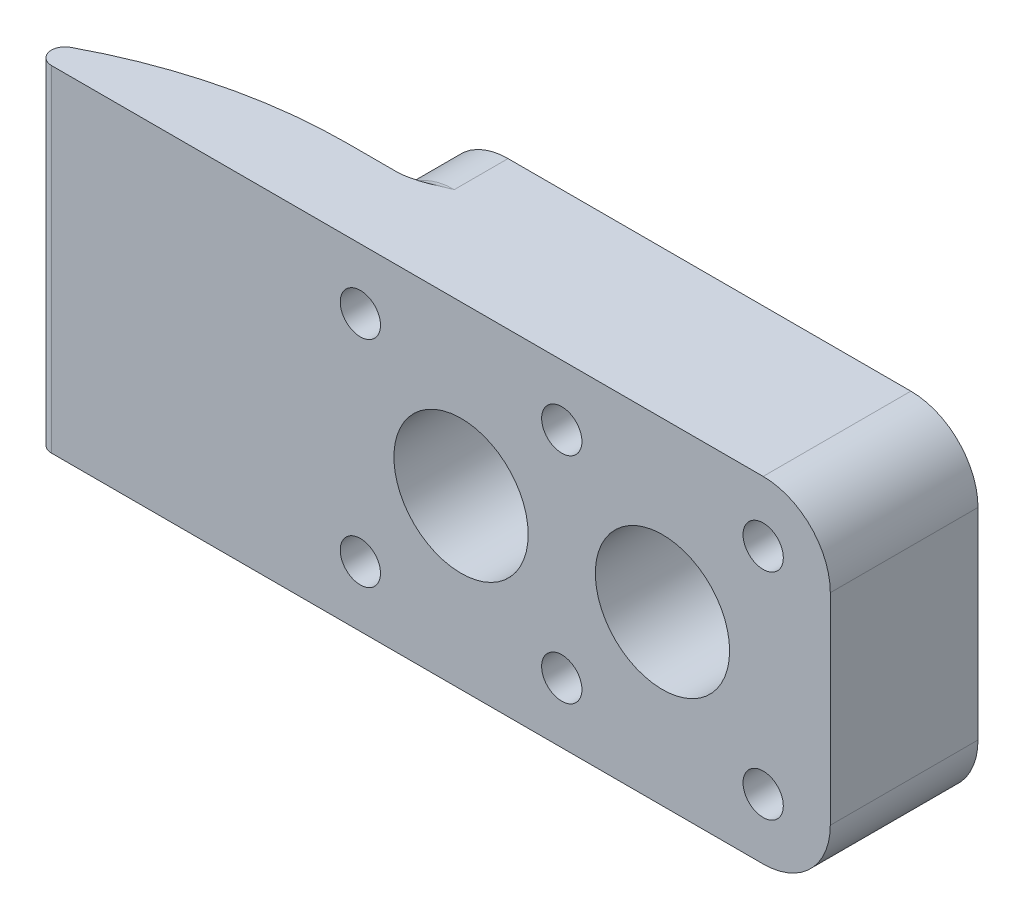
from build123d import *

# Parameters (mm, degrees)
SKETCH_2_W           = 40
SKETCH_2_H           = 25
EXTRUDE_1_DEPTH      = 5
SKETCH_3_R           = 1.5
CUT_EXTRUDE_1_DEPTH  = 25.109126902
SKETCH_4_R           = 5
CUT_EXTRUDE_2_DEPTH  = 25.109126902
EXTRUDE_2_DEPTH      = 12.5
EXTRUDE_2_DEPTH_BACK = 12.5
SKETCH_7_R           = 5
SKETCH_7_R_2         = 1.5
CUT_EXTRUDE_3_DEPTH  = 43.405777908
FILLET_1_R           = 5
FILLET_2_R           = 1


with BuildPart() as part:
    # 草图2 → 凸台-拉伸1 (new body)
    with BuildSketch(Plane.XY):
        Rectangle(SKETCH_2_W, SKETCH_2_H)
    extrude(amount=EXTRUDE_1_DEPTH)

    # 草图3 → 切除-拉伸1 (cut, through all)
    with BuildSketch(Plane.XY.offset(5)):
        with Locations((-15, 8)):
            Circle(SKETCH_3_R)
        with Locations((0, 8)):
            Circle(SKETCH_3_R)
        with Locations(Location((15, 8, 0), (0, 0, 180))):
            Circle(SKETCH_3_R)
        with Locations((15, -8)):
            Circle(SKETCH_3_R)
        with Locations(Location((0, -8, 0), (0, 0, 180))):
            Circle(SKETCH_3_R)
        with Locations(Location((-15, -8, 0), (0, 0, 180))):
            Circle(SKETCH_3_R)
    extrude(amount=-CUT_EXTRUDE_1_DEPTH, mode=Mode.SUBTRACT)

    # 草图4 → 切除-拉伸2 (cut, through all)
    with BuildSketch(Plane.XY.offset(5)):
        with Locations((-7.5, 0)):
            Circle(SKETCH_4_R)
        with Locations(Location((7.5, 0, 0), (0, 0, 180))):
            Circle(SKETCH_4_R)
    extrude(amount=-CUT_EXTRUDE_2_DEPTH, mode=Mode.SUBTRACT)

    # 草图6 → 凸台-拉伸2 (add, two sides: drawn at the far end of the back side and taken through both)
    with BuildSketch(Plane(origin=(0, 0, 0), x_dir=(1, 0, 0), z_dir=(0, 1, 0)).offset(-EXTRUDE_2_DEPTH_BACK)):
        with BuildLine():
            Line((-20, -5), (-22, -5))
            ThreePointArc((-22, -5), (-30.488746876, -6.045012495), (-38.470588235, -9.117647059))
            ThreePointArc((-38.470588235, -9.117647059), (-38.9701425, -10.242535625), (-38, -11))
            Line((-38, -11), (20, -11))
            Line((20, -11), (20, -5))
            Line((20, -5), (-20, -5))
        make_face()
    extrude(amount=EXTRUDE_2_DEPTH + EXTRUDE_2_DEPTH_BACK)

    # 草图7 → 切除-拉伸3 (cut, through all)
    with BuildSketch(Plane.XY.offset(11)):
        with Locations((7.5, 0)):
            Circle(SKETCH_7_R)
        with Locations((-15, -8)):
            Circle(SKETCH_7_R_2)
        with Locations((-7.5, 0)):
            Circle(SKETCH_7_R)
        with Locations((0, -8)):
            Circle(SKETCH_7_R_2)
        with Locations((15, -8)):
            Circle(SKETCH_7_R_2)
        with Locations((0, 8)):
            Circle(SKETCH_7_R_2)
        with Locations((-15, 8)):
            Circle(SKETCH_7_R_2)
        with Locations((15, 8)):
            Circle(SKETCH_7_R_2)
    extrude(amount=-CUT_EXTRUDE_3_DEPTH, mode=Mode.SUBTRACT)

    # 圆角1
    fillet_1_edges = [part.edges().sort_by_distance(p)[0] for p in [
        (20, -12.5, 5.5),
        (-20, -12.5, 2.5),
        (-20, 12.5, 2.5),
        (20, 12.5, 5.5),
    ]]
    fillet(fillet_1_edges, radius=FILLET_1_R)

    # 圆角2
    # the kernel refuses this fillet: 1 mm, written as the material it adds along each edge
    with BuildSketch(Plane(origin=(-20, 7.5, 5), x_dir=(0, 0, -1), z_dir=(0, -1, 0))) as fillet_2_piece_1:
        with BuildLine():
            CenterArc((FILLET_2_R, -FILLET_2_R), FILLET_2_R, 90, 90)
            Line((0, -FILLET_2_R), (0, 0))
            Line((0, 0), (FILLET_2_R, 0))
        make_face()
    extrude(amount=15)
    with BuildSketch(Plane(origin=(-15, -7.5, 5), x_dir=(0.7515057138603054, -0.6597265812708418, 0), z_dir=(0.6597265812708418, 0.7515057138603054, 0))) as fillet_2_piece_2_section:
        with BuildLine():
            CenterArc((5 + FILLET_2_R, FILLET_2_R), FILLET_2_R, 180, 90)
            Line((5, FILLET_2_R), (5, 0))
            Line((5, 0), (5 + FILLET_2_R, 0))
        make_face()
    fillet_2_piece_2 = revolve(axis=Axis((-15, -7.5, 5), (0, 0, -1)), revolution_arc=138.720976341, mode=Mode.PRIVATE)
    fillet_2_piece_2 = split(fillet_2_piece_2, bisect_by=Plane(origin=(-15, -12.5, 5), z_dir=(0, 1, 0)), keep=Keep.TOP, mode=Mode.PRIVATE)
    add(fillet_2_piece_2)
    with BuildSketch(Plane(origin=(-15, 7.5, 5), x_dir=(0.7515057138603056, 0.6597265812708417, 0), z_dir=(0.6597265812708417, -0.7515057138603056, 0))) as fillet_2_piece_3_section:
        with BuildLine():
            CenterArc((5 + FILLET_2_R, -FILLET_2_R), FILLET_2_R, 90, 90)
            Line((5 + FILLET_2_R, 0), (5, 0))
            Line((5, 0), (5, -FILLET_2_R))
        make_face()
    fillet_2_piece_3 = revolve(axis=Axis((-15, 7.5, 5), (0, 0, 1)), revolution_arc=138.720976341, mode=Mode.PRIVATE)
    fillet_2_piece_3 = split(fillet_2_piece_3, bisect_by=Plane(origin=(-15, 12.5, 5), z_dir=(0, -1, 0)), keep=Keep.TOP, mode=Mode.PRIVATE)
    add(fillet_2_piece_3)


solid = part.part
